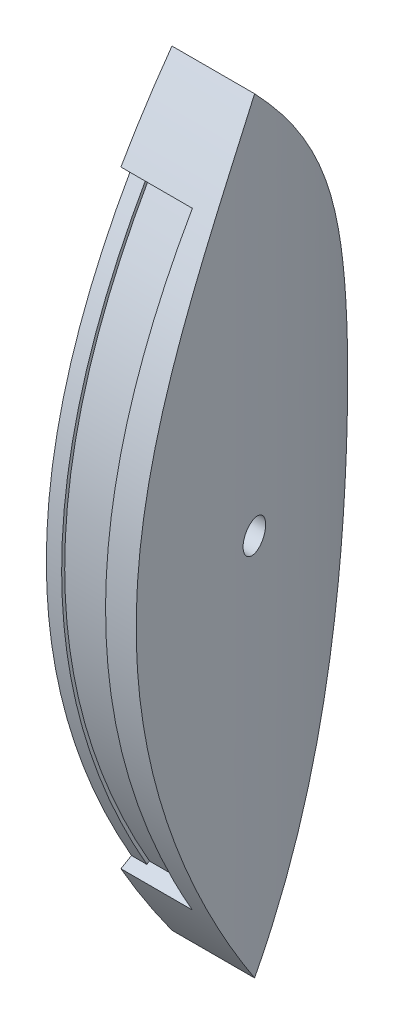
from build123d import *

# Parameters (mm, degrees)
BOSS_EXTRUDE1_DEPTH = 20
SKETCH3_R           = 1.5
CUT_EXTRUDE2_DEPTH  = 20
SKETCH4_R           = 3
CUT_EXTRUDE4_DEPTH  = 10
CUT_EXTRUDE1_START  = -75.0000001
CUT_EXTRUDE1_DEPTH  = 150.0000002


# Read off the part's stored shape, not the designer's step: Cut-Extrude1
with BuildPart() as part:
    # Sketch1 → Boss-Extrude1 (new body)
    with BuildSketch(Plane(origin=(0, 0, 0), x_dir=(0, 0, -1), z_dir=(1, 0, 0))):
        with BuildLine():
            add(Edge.make_bspline(
                [(0, -75), (-54.00752431, -0.229525707), (0, 75)],
                knots=[0, 0, 0, 1, 1, 1], degree=2))
            add(Edge.make_bspline(
                [(0, -75), (68.837827029, 3.494171235), (0, 75)],
                knots=[0, 0, 0, 1, 1, 1], degree=2))
        make_face()
    extrude(amount=BOSS_EXTRUDE1_DEPTH)

    # Sketch3 → Cut-Extrude2 (cut)
    with BuildSketch(Plane(origin=(0, 0, 0), x_dir=(0, 0, -1), z_dir=(1, 0, 0))):
        with Locations(Location((0, 0, 0), (0, 0, 180))):
            Circle(SKETCH3_R)
    extrude(amount=CUT_EXTRUDE2_DEPTH, mode=Mode.SUBTRACT)

    # Sketch4 → Cut-Extrude4 (cut)
    with BuildSketch(Plane(origin=(20, 0, 0), x_dir=(0, 0, -1), z_dir=(1, 0, 0))):
        Circle(SKETCH4_R)
    extrude(amount=-CUT_EXTRUDE4_DEPTH, mode=Mode.SUBTRACT)

    # Cut-Extrude1 outline → Cut-Extrude1 (cut)
    with BuildSketch(Plane(origin=(0, 0, 0), x_dir=(0, 0, -1), z_dir=(0, -1, 0)).offset(CUT_EXTRUDE1_START)):
        with BuildLine():
            Line((34.418913514, 0), (34.418913514, 20))
            Line((34.418913514, 20), (-27.003762155, 20))
            add(Edge.make_bspline(
                [(-27.003762155, 20), (7.680747014, 19.015790773), (34.418913514, 0)],
                knots=[0, 0, 0, 1, 1, 1], degree=2))
        make_face()
    extrude(amount=CUT_EXTRUDE1_DEPTH, mode=Mode.SUBTRACT)

    # Cut-Sweep2: sweep along a path in Sketch6
    with BuildLine() as cut_sweep2_path:  # in the path sketch's own coordinates; laid on its plane below (add() does not lay a ready-made edge on the line's plane)
        add(Edge.make_bspline(
            [(10, 59.471843264), (21.504457752, 39.289752245), (32.671682873, -0.43393523), (21.167225121, -40.061270692), (10, -59.556840941)],
            knots=[0.103237719, 0.103237719, 0.103237719, 0.103237719, 0.505901687, 0.896762281, 0.896762281, 0.896762281, 0.896762281], degree=3))
    # Sketch5 → Cut-Sweep2 (sweep, cut)
    with BuildSketch(Plane(origin=(0, 0, 0), x_dir=(1, 0, 0), z_dir=(0, 1, 0))):
        Polygon((14, -30.003762155), (14, -24.003762155), (3, -24.003762155), (3, -24.603762155), (0, -24.603762155), (0, -30.003762155), align=None)
    sweep(path=Plane.ZY * cut_sweep2_path.line, mode=Mode.SUBTRACT)


solid = part.part
